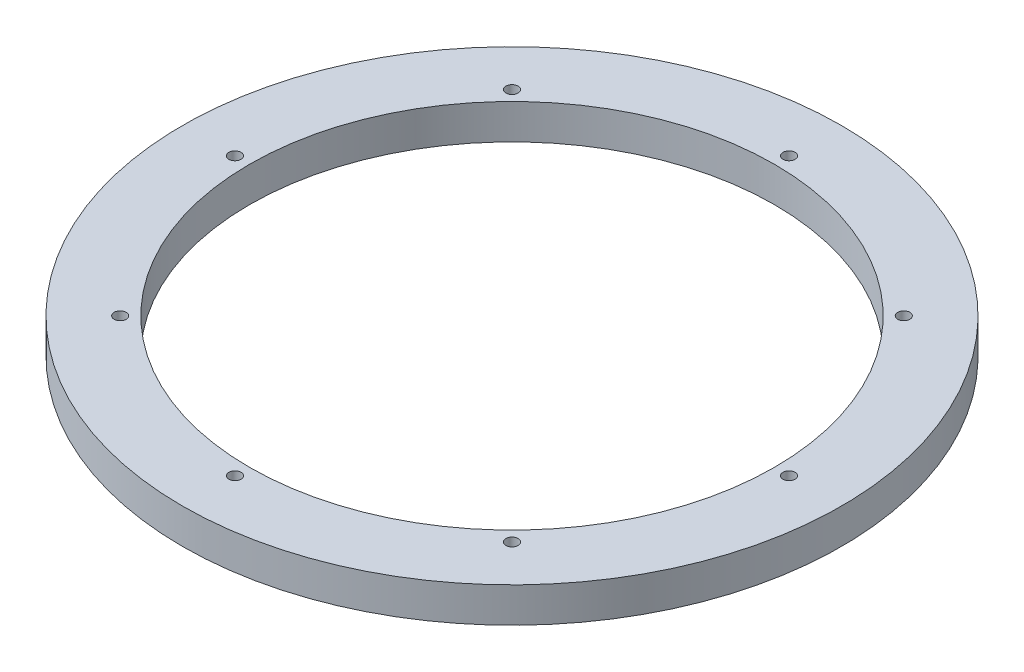
from build123d import *

# Parameters (mm, degrees)
SKETCH1_R           = 71.755
SKETCH1_R_2         = 1.3208
SKETCH1_R_3         = 57.15
BOSS_EXTRUDE1_DEPTH = 7.62


with BuildPart() as part:
    # Sketch1 → Boss-Extrude1 (new body)
    with BuildSketch(Plane(origin=(0, 0, 0), x_dir=(1, 0, 0), z_dir=(0, 1, 0))):
        Circle(SKETCH1_R)
        with Locations((42.656216575, 42.656216575)):
            Circle(SKETCH1_R_2, mode=Mode.SUBTRACT)
        with Locations((-42.656216575, -42.656216575)):
            Circle(SKETCH1_R_2, mode=Mode.SUBTRACT)
        with Locations((0, -60.325)):
            Circle(SKETCH1_R_2, mode=Mode.SUBTRACT)
        with Locations((42.656216575, -42.656216575)):
            Circle(SKETCH1_R_2, mode=Mode.SUBTRACT)
        with Locations((-60.325, 0)):
            Circle(SKETCH1_R_2, mode=Mode.SUBTRACT)
        with Locations((-42.656216575, 42.656216575)):
            Circle(SKETCH1_R_2, mode=Mode.SUBTRACT)
        Circle(SKETCH1_R_3, mode=Mode.SUBTRACT)
        with Locations((60.325, 0)):
            Circle(SKETCH1_R_2, mode=Mode.SUBTRACT)
        with Locations((0, 60.325)):
            Circle(SKETCH1_R_2, mode=Mode.SUBTRACT)
    extrude(amount=BOSS_EXTRUDE1_DEPTH)


solid = part.part
